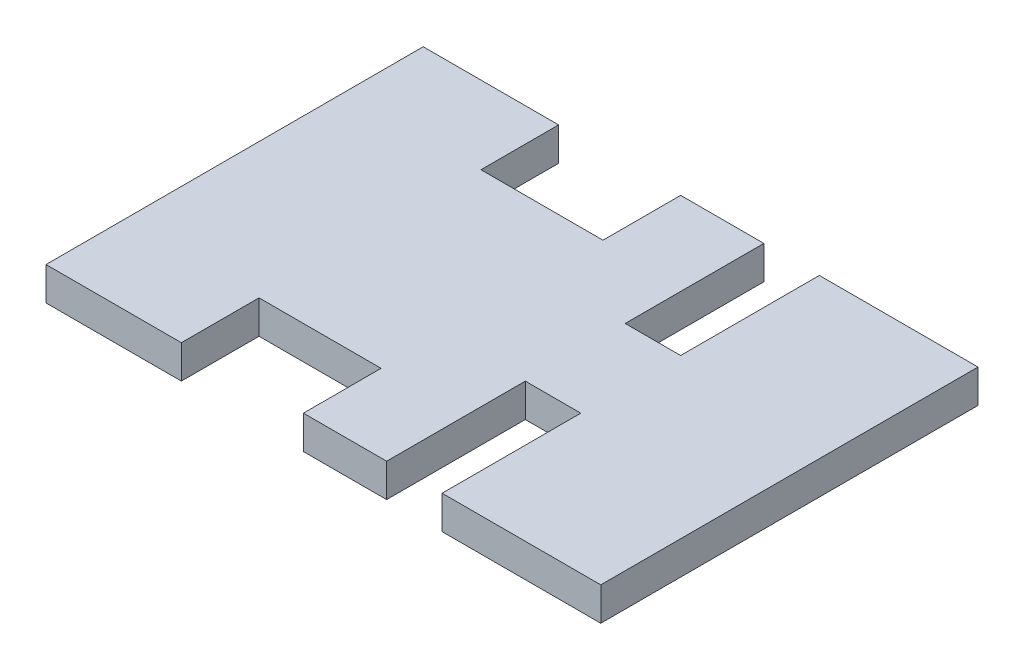
from build123d import *

# Parameters (mm, degrees)
SKETCH1_W           = 100
SKETCH1_H           = 68
BOSS_EXTRUDE1_DEPTH = 6
SKETCH2_W           = 10
SKETCH2_H           = 25
CUT_EXTRUDE1_DEPTH  = 61.761830124
SKETCH3_W           = 22
SKETCH3_H           = 14
CUT_EXTRUDE2_DEPTH  = 61.761830124


with BuildPart() as part:
    # Sketch1 → Boss-Extrude1 (new body)
    with BuildSketch(Plane(origin=(0, 0, 0), x_dir=(1, 0, 0), z_dir=(0, 1, 0))):
        Rectangle(SKETCH1_W, SKETCH1_H)
    extrude(amount=BOSS_EXTRUDE1_DEPTH)

    # Sketch2 → Cut-Extrude1 (cut, through all)
    with BuildSketch(Plane.XZ):
        with Locations((16.4, -21.5)):
            Rectangle(SKETCH2_W, SKETCH2_H)
    cut_extrude1 = extrude(amount=-CUT_EXTRUDE1_DEPTH, mode=Mode.SUBTRACT)

    # Sketch3 → Cut-Extrude2 (cut, through all)
    with BuildSketch(Plane.XZ):
        with Locations((-14.6, -27)):
            Rectangle(SKETCH3_W, SKETCH3_H)
    cut_extrude2 = extrude(amount=-CUT_EXTRUDE2_DEPTH, mode=Mode.SUBTRACT)

    # Mirror1: Cut-Extrude1, Cut-Extrude2 across plane
    add(cut_extrude1.mirror(Plane.XY), mode=Mode.SUBTRACT)
    add(cut_extrude2.mirror(Plane.XY), mode=Mode.SUBTRACT)


solid = part.part
